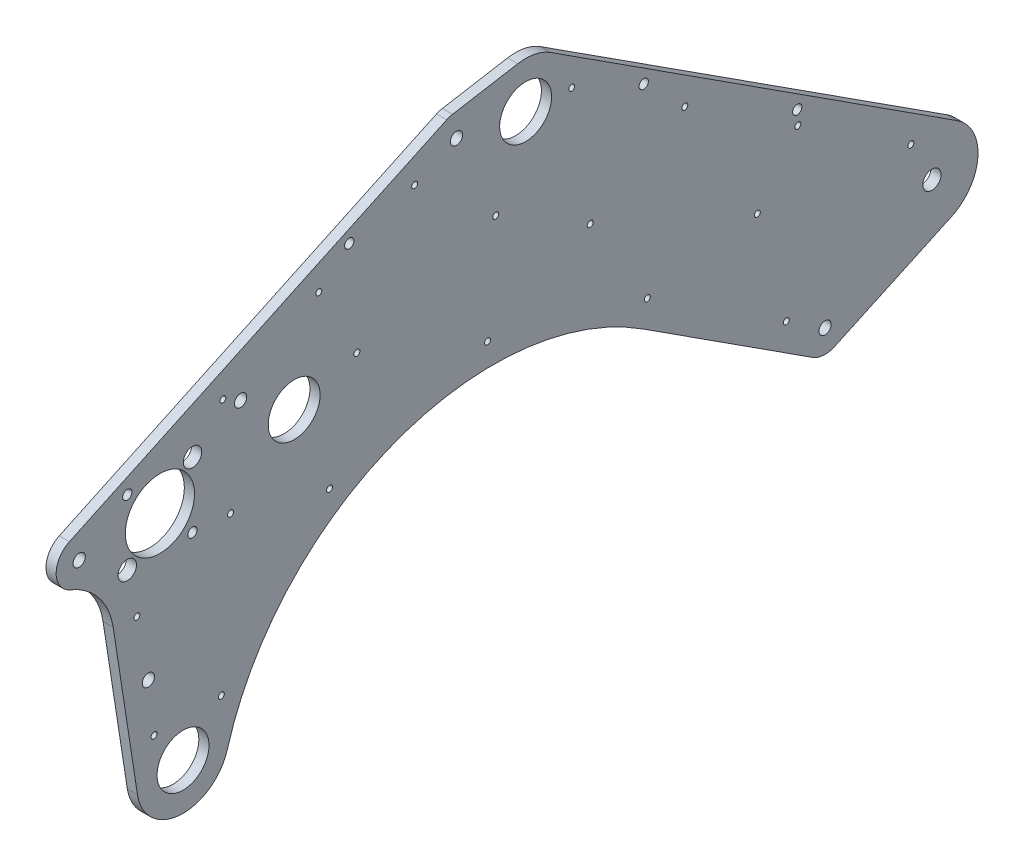
from build123d import *

# Parameters (mm, degrees)
SKETCH2_R           = 14.2875
SKETCH2_R_2         = 19.05
SKETCH2_R_3         = 5.0419
SKETCH2_R_4         = 3.3782
SKETCH2_R_5         = 5.08
SKETCH2_R_6         = 2.5527
BOSS_EXTRUDE1_DEPTH = 5.588
SKETCH4_R           = 2.5527
CUT_EXTRUDE1_DEPTH  = 512.363731997
SKETCH6_R           = 1.651
CUT_EXTRUDE2_DEPTH  = 512.363731997


with BuildPart() as part:
    # Sketch2 → Boss-Extrude1 (new body)
    with BuildSketch(Plane(origin=(0, 0, 0), x_dir=(0, 0, -1), z_dir=(1, 0, 0))):
        with BuildLine():
            Line((-437.546257165, -74.524343451), (-450.925675972, 12.053916333))
            ThreePointArc((-450.925675972, 12.053916333), (-458.738197339, 29.923843863), (-474.369924043, 41.586558826))
            ThreePointArc((-474.369924043, 41.586558826), (-482.328689132, 53.015195424), (-475.021326618, 64.870916799))
            Line((-475.021326618, 64.870916799), (-267.255494276, 162.202987762))
            ThreePointArc((-267.255494276, 162.202987762), (-265.669363705, 162.82010746), (-264.014960339, 163.219602661))
            Line((-264.014960339, 163.219602661), (-228.062096944, 169.38678303))
            ThreePointArc((-228.062096944, 169.38678303), (-218.683785088, 169.238413352), (-209.998738488, 165.696561803))
            Line((-209.998738488, 165.696561803), (13.769085246, 21.344139512))
            ThreePointArc((13.769085246, 21.344139512), (25.338001676, -1.773603978), (10.661298989, -23.05421228))
            Line((10.661298989, -23.05421228), (-53.518911784, -52.734012568))
            ThreePointArc((-53.518911784, -52.734012568), (-59.736363268, -53.875907265), (-65.734103901, -51.878976183))
            Line((-65.734103901, -51.878976183), (-158.960479855, 8.261275287))
            ThreePointArc((-158.960479855, 8.261275287), (-295.100616648, 22.88759924), (-388.034332347, -77.667811776))
            ThreePointArc((-388.034332347, -77.667811776), (-414.053605713, -95.994148997), (-437.546257165, -74.524343451))
        make_face()
        with Locations((-223.767823734, 144.352422291)):
            Circle(SKETCH2_R, mode=Mode.SUBTRACT)
        with Locations((-351.246969331, 65.939769964)):
            Circle(SKETCH2_R, mode=Mode.SUBTRACT)
        with Locations((-412.444222517, -70.645186775)):
            Circle(SKETCH2_R, mode=Mode.SUBTRACT)
        with Locations((-425.183656076, 53.370351328)):
            Circle(SKETCH2_R_2, mode=Mode.SUBTRACT)
        Circle(SKETCH2_R_3, mode=Mode.SUBTRACT)
        with Locations((-58.849561279, -41.206906428)):
            Circle(SKETCH2_R_4, mode=Mode.SUBTRACT)
        with Locations((-261.867823734, 150.702422291)):
            Circle(SKETCH2_R_4, mode=Mode.SUBTRACT)
        with Locations((-407.223143834, 71.330863571)):
            Circle(SKETCH2_R_5, mode=Mode.SUBTRACT)
        with Locations((-443.144168318, 71.330863571)):
            Circle(SKETCH2_R_6, mode=Mode.SUBTRACT)
        with Locations((-443.144168318, 35.409839086)):
            Circle(SKETCH2_R_5, mode=Mode.SUBTRACT)
        with Locations((-407.223143834, 35.409839086)):
            Circle(SKETCH2_R_6, mode=Mode.SUBTRACT)
        with Locations((-469.633656076, 53.370351328)):
            Circle(SKETCH2_R_4, mode=Mode.SUBTRACT)
        with Locations((-431.533656076, -22.829648672)):
            Circle(SKETCH2_R_4, mode=Mode.SUBTRACT)
        with Locations((-380.733656076, 85.120351328)):
            Circle(SKETCH2_R_4, mode=Mode.SUBTRACT)
    extrude(amount=BOSS_EXTRUDE1_DEPTH)

    # Sketch4 → Cut-Extrude1 (cut, through all)
    with BuildSketch(Plane(origin=(5.588, 0, 0), x_dir=(0, 0, -1), z_dir=(1, 0, 0))):
        with Locations((-320.871401883, 130.073276667)):
            Circle(SKETCH4_R)
        with Locations((-158.716059535, 125.057510617)):
            Circle(SKETCH4_R)
        with Locations((-74.194622801, 70.532807626)):
            Circle(SKETCH4_R)
    extrude(amount=-CUT_EXTRUDE1_DEPTH, mode=Mode.SUBTRACT)

    # Sketch6 → Cut-Extrude2 (cut, through all)
    with BuildSketch(Plane(origin=(5.588, 0, 0), x_dir=(0, 0, -1), z_dir=(1, 0, 0))):
        with Locations((-11.600024416, 22.596447366)):
            Circle(SKETCH6_R)
        with Locations((-156.756374659, 21.843225212)):
            Circle(SKETCH6_R)
        with Locations((-73.855957522, 62.757693946)):
            Circle(SKETCH6_R)
        with Locations((-244.744085427, 45.266020038)):
            Circle(SKETCH6_R)
        with Locations((-284.868954674, 139.927081208)):
            Circle(SKETCH6_R)
        with Locations((-331.767923105, 18.483259923)):
            Circle(SKETCH6_R)
        with Locations((-391.359776395, -50.359136789)):
            Circle(SKETCH6_R)
        with Locations((-437.845403333, 10.568681915)):
            Circle(SKETCH6_R)
        with Locations((-337.681974157, 115.185763052)):
            Circle(SKETCH6_R)
        with Locations((-390.494993639, 90.444444895)):
            Circle(SKETCH6_R)
        with Locations((-136.111890628, 102.918940527)):
            Circle(SKETCH6_R)
        with Locations((-80.19370079, -27.437821182)):
            Circle(SKETCH6_R)
        with Locations((-428.354688068, -50.845765421)):
            Circle(SKETCH6_R)
        with Locations((-198.367823734, 143.080187108)):
            Circle(SKETCH6_R)
        with Locations((-240.215603425, 103.020132422)):
            Circle(SKETCH6_R)
        with Locations((-386.256614309, 33.959370646)):
            Circle(SKETCH6_R)
        with Locations((-316.6917755, 75.797360593)):
            Circle(SKETCH6_R)
        with Locations((-188.192864503, 73.014198713)):
            Circle(SKETCH6_R)
        with Locations((-96.161159822, 31.869379807)):
            Circle(SKETCH6_R)
    extrude(amount=-CUT_EXTRUDE2_DEPTH, mode=Mode.SUBTRACT)


solid = part.part
